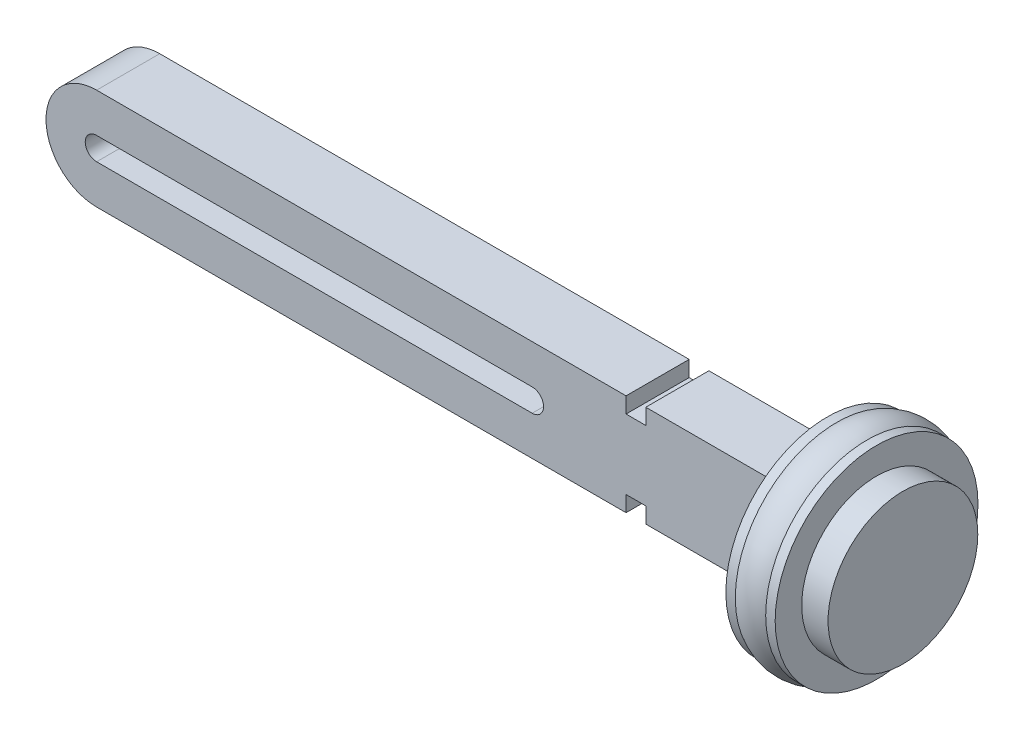
from build123d import *

# Parameters (mm, degrees)
BOSS_EXTRUDE1_DEPTH = 8
SKETCH2_R           = 12.855
BOSS_EXTRUDE2_DEPTH = 6.25
SKETCH3_R           = 9.49
BOSS_EXTRUDE3_DEPTH = 3.34
CUT_EXTRUDE1_DEPTH  = 43.34
SKETCH6_W           = 2.5
SKETCH6_H           = 2
CUT_EXTRUDE2_DEPTH  = 53.34


with BuildPart() as part:
    # Sketch1 → Boss-Extrude1 (new body)
    with BuildSketch(Plane.XY):
        with BuildLine():
            Line((-44.3, 6.415), (44.3, 6.415))
            Line((44.3, 6.415), (44.3, -6.415))
            Line((44.3, -6.415), (-44.3, -6.415))
            ThreePointArc((-44.3, -6.415), (-50.715, 0), (-44.3, 6.415))
        make_face()
    extrude(amount=BOSS_EXTRUDE1_DEPTH)

    # Sketch2 → Boss-Extrude2 (add)
    with BuildSketch(Plane(origin=(44.3, 0, 0), x_dir=(0, 0, -1), z_dir=(1, 0, 0))):
        with Locations((-4, 0)):
            Circle(SKETCH2_R)
    extrude(amount=BOSS_EXTRUDE2_DEPTH)

    # Sketch3 → Boss-Extrude3 (add)
    with BuildSketch(Plane(origin=(50.55, 0, 0), x_dir=(0, 0, -1), z_dir=(1, 0, 0))):
        with Locations((-4, 0)):
            Circle(SKETCH3_R)
    extrude(amount=BOSS_EXTRUDE3_DEPTH)

    # Sketch4 → Revolve1 (revolve)
    with BuildSketch(Plane(origin=(0, 0, 0), x_dir=(1, 0, 0), z_dir=(0, 1, 0))):
        with BuildLine():
            Line((45.5, 8.855), (49.35, 8.855))
            ThreePointArc((49.35, 8.855), (47.425, 9.351345894), (45.5, 8.855))
        make_face()
    revolve(axis=Axis((37.822014595, 0, 4), (1, 0, 0)))

    # Sketch5 → Cut-Extrude1 (cut)
    with BuildSketch(Plane.XY.offset(8)):
        with BuildLine():
            Line((-44.3, 1.445), (10.9, 1.445))
            ThreePointArc((10.9, 1.445), (12.345, 0), (10.9, -1.445))
            Line((10.9, -1.445), (-44.3, -1.445))
            ThreePointArc((-44.3, -1.445), (-45.745, 0), (-44.3, 1.445))
        make_face()
    extrude(amount=-CUT_EXTRUDE1_DEPTH, mode=Mode.SUBTRACT)

    # Sketch6 → Cut-Extrude2 (cut)
    with BuildSketch(Plane.XY.offset(8)):
        with Locations((24.05, 5.415)):
            Rectangle(SKETCH6_W, SKETCH6_H)
        with Locations((24.05, -5.415)):
            Rectangle(SKETCH6_W, SKETCH6_H)
    extrude(amount=-CUT_EXTRUDE2_DEPTH, mode=Mode.SUBTRACT)


solid = part.part
